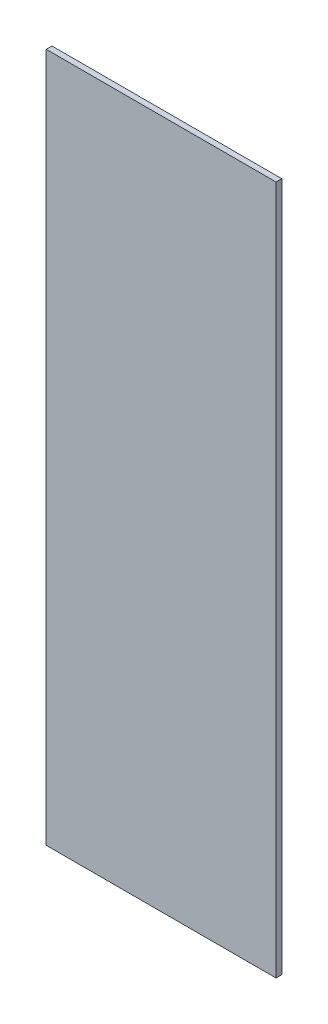
from build123d import *

# Parameters (mm, degrees)
SKETCH1_W           = 300
SKETCH1_H           = 100
BOSS_EXTRUDE1_DEPTH = 2.5


with BuildPart() as part:
    # Sketch1 → Boss-Extrude1 (new body)
    with BuildSketch(Plane(origin=(0, 0, 0), x_dir=(0, 1, 0), z_dir=(0, 0, 1))):
        Rectangle(SKETCH1_W, SKETCH1_H)
    extrude(amount=BOSS_EXTRUDE1_DEPTH)


solid = part.part
